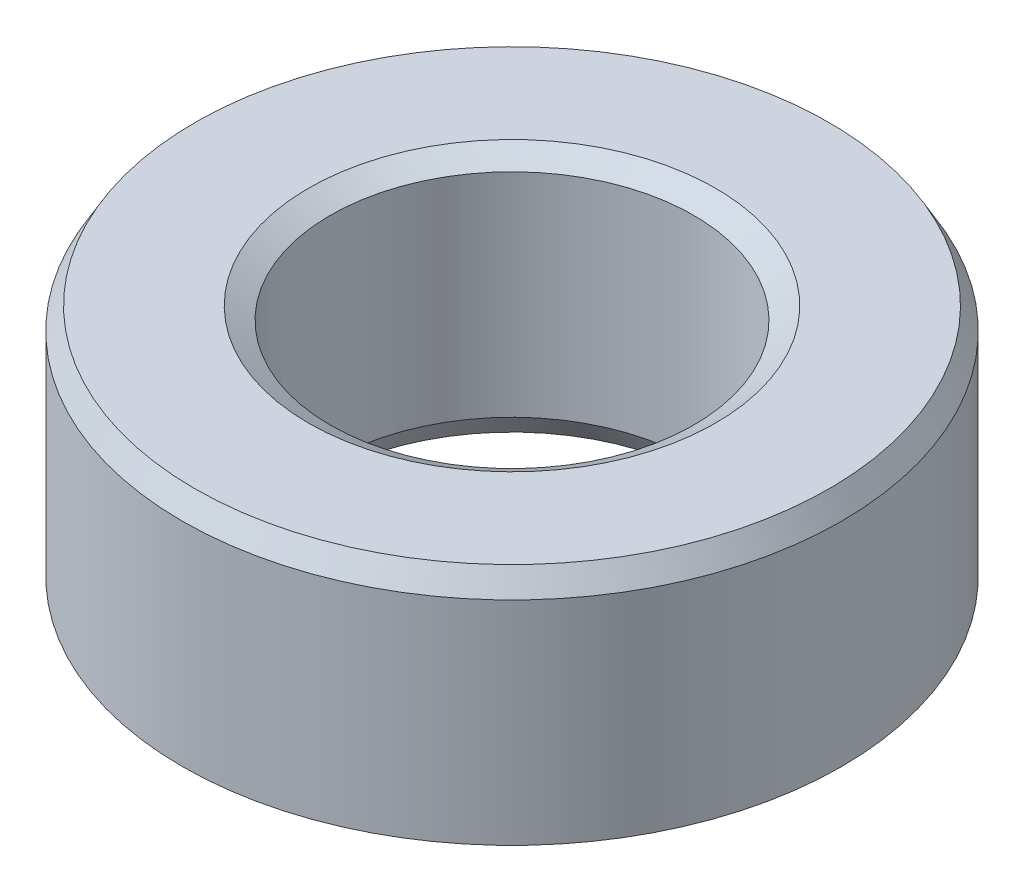
from build123d import *
from OCP.BRepFilletAPI import BRepFilletAPI_MakeChamfer

# Parameters (mm, degrees)
SKETCH1_R           = 60
BOSS_EXTRUDE1_DEPTH = 44.928254931
SKETCH2_R           = 33.072198395
CUT_EXTRUDE1_DEPTH  = 97.013270391
CHAMFER1_SIZE       = 3.962428813
CHAMFER1_SIZE2      = 2.287709342


with BuildPart() as part:
    # Sketch1 → Boss-Extrude1 (new body)
    with BuildSketch(Plane(origin=(0, 0, 0), x_dir=(1, 0, 0), z_dir=(0, 1, 0))):
        Circle(SKETCH1_R)
    extrude(amount=BOSS_EXTRUDE1_DEPTH)

    # Sketch2 → Cut-Extrude1 (cut, through all)
    with BuildSketch(Plane(origin=(0, 0, 0), x_dir=(1, 0, 0), z_dir=(0, 1, 0))):
        Circle(SKETCH2_R)
    extrude(amount=CUT_EXTRUDE1_DEPTH, mode=Mode.SUBTRACT)

    # Chamfer1: one chamfer whose edges measure the first distance from different faces: ONE call of the kernel's chamfer builder (chamfer() names one face for all edges)
    chamfer1_edges_1 = [part.edges().sort_by_distance(p)[0] for p in [
        (-33.072198395, 44.928254931, 0),
    ]]
    chamfer1_side_1 = [part.faces().sort_by_distance(p)[0] for p in [
        (-58.302943725, 44.928254931, 0),
    ]]
    chamfer1_edges_2 = [part.edges().sort_by_distance(p)[0] for p in [
        (-33.072198395, 0, 0),
    ]]
    chamfer1_side_2 = [part.faces().sort_by_distance(p)[0] for p in [
        (-33.072198395, 22.464127465, 0),
    ]]
    chamfer1_edges_3 = [part.edges().sort_by_distance(p)[0] for p in [
        (-60, 0, 0),
    ]]
    chamfer1_side_3 = [part.faces().sort_by_distance(p)[0] for p in [
        (-58.302943725, 0, 0),
    ]]
    chamfer1_edges_4 = [part.edges().sort_by_distance(p)[0] for p in [
        (-60, 44.928254931, 0),
    ]]
    chamfer1_side_4 = [part.faces().sort_by_distance(p)[0] for p in [
        (-60, 22.464127465, 0),
    ]]
    chamfer1 = BRepFilletAPI_MakeChamfer(part.part.solid().wrapped)
    for e in chamfer1_edges_1:
        chamfer1.Add(CHAMFER1_SIZE, CHAMFER1_SIZE2, e.wrapped, chamfer1_side_1[0].wrapped)  # the first distance lies on this face
    for e in chamfer1_edges_2:
        chamfer1.Add(CHAMFER1_SIZE, CHAMFER1_SIZE2, e.wrapped, chamfer1_side_2[0].wrapped)  # the first distance lies on this face
    for e in chamfer1_edges_3:
        chamfer1.Add(CHAMFER1_SIZE, CHAMFER1_SIZE2, e.wrapped, chamfer1_side_3[0].wrapped)  # the first distance lies on this face
    for e in chamfer1_edges_4:
        chamfer1.Add(CHAMFER1_SIZE, CHAMFER1_SIZE2, e.wrapped, chamfer1_side_4[0].wrapped)  # the first distance lies on this face
    add(Compound.cast(chamfer1.Shape()), mode=Mode.REPLACE)


solid = part.part
